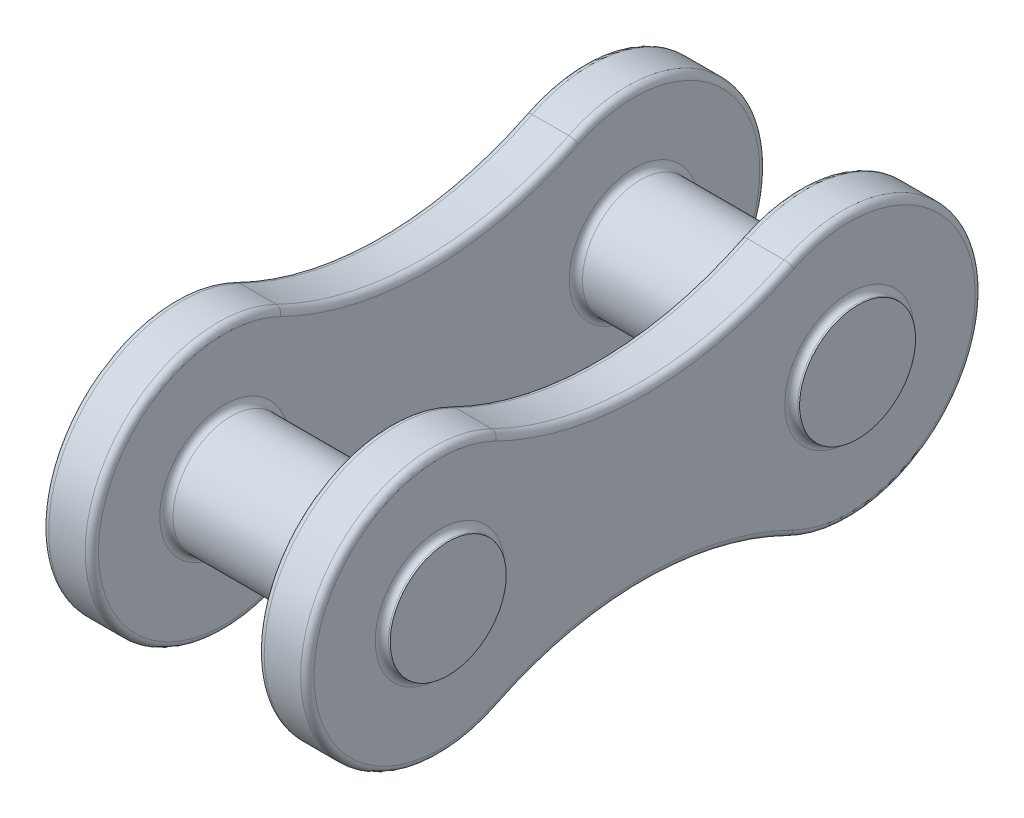
from build123d import *

# Parameters (mm, degrees)
SALIENTE_EXTRUIR1_START = 2.5
CROQUIS1_R              = 1.75
SALIENTE_EXTRUIR1_DEPTH = 1.5
SALIENTE_EXTRUIR2_START = -2.5
CROQUIS2_R              = 1.75
SALIENTE_EXTRUIR2_DEPTH = 1.5
CROQUIS3_R              = 1.75
SALIENTE_EXTRUIR3_DEPTH = 4.25
REDONDEO1_R             = 0.2


with BuildPart() as part:
    # Croquis1 → Saliente-Extruir1 (new body)
    with BuildSketch(Plane(origin=(0, 0, 0), x_dir=(0, 0, -1), z_dir=(1, 0, 0)).offset(SALIENTE_EXTRUIR1_START)):
        with BuildLine():
            ThreePointArc((-4.410714286, 3.589888009), (-10.175, 0), (-4.410714286, -3.589888009))
            ThreePointArc((-4.410714286, -3.589888009), (0, -2.564608032), (4.410714286, -3.589888009))
            ThreePointArc((4.410714286, -3.589888009), (10.175, 0), (4.410714286, 3.589888009))
            ThreePointArc((4.410714286, 3.589888009), (0, 2.564608032), (-4.410714286, 3.589888009))
        make_face()
        with Locations((-6.175, 0)):
            Circle(CROQUIS1_R, mode=Mode.SUBTRACT)
        with Locations((6.175, 0)):
            Circle(CROQUIS1_R, mode=Mode.SUBTRACT)
    extrude(amount=SALIENTE_EXTRUIR1_DEPTH)



with BuildPart() as body_2:
    # Croquis2 → Saliente-Extruir2 (new body)
    with BuildSketch(Plane(origin=(0, 0, 0), x_dir=(0, 0, -1), z_dir=(1, 0, 0)).offset(SALIENTE_EXTRUIR2_START)):
        with BuildLine():
            ThreePointArc((-4.410714286, 3.589888009), (0, 2.564608032), (4.410714286, 3.589888009))
            ThreePointArc((4.410714286, 3.589888009), (10.175, 0), (4.410714286, -3.589888009))
            ThreePointArc((4.410714286, -3.589888009), (0, -2.564608032), (-4.410714286, -3.589888009))
            ThreePointArc((-4.410714286, -3.589888009), (-10.175, 0), (-4.410714286, 3.589888009))
        make_face()
        with Locations((6.175, 0)):
            Circle(CROQUIS2_R, mode=Mode.SUBTRACT)
        with Locations((-6.175, 0)):
            Circle(CROQUIS2_R, mode=Mode.SUBTRACT)
    extrude(amount=-SALIENTE_EXTRUIR2_DEPTH)


with BuildPart() as part_1:
    add(part.part)

    add(body_2.part)  # Saliente-Extruir3 merges body 2
    # Croquis3 → Saliente-Extruir3 (add, symmetric)
    with BuildSketch(Plane(origin=(0, 0, 0), x_dir=(0, 0, -1), z_dir=(1, 0, 0))):
        with Locations((6.175, 0)):
            Circle(CROQUIS3_R)
        with Locations((-6.175, 0)):
            Circle(CROQUIS3_R)
    extrude(amount=SALIENTE_EXTRUIR3_DEPTH, both=True)

    # Redondeo1
    redondeo1_edges = [part_1.edges().sort_by_distance(p)[0] for p in [
        (2.5, 0, -4.425),
        (2.5, 0, 7.925),
        (2.5, 0, 10.175),
        (2.5, -2.564608032, 0),
        (2.5, 0, -10.175),
        (2.5, 2.564608032, 0),
        (-4, -2.564608032, 0),
        (-4, 0, -10.175),
        (-4, 2.564608032, 0),
        (-4, 0, 10.175),
        (-4, 0, -4.425),
        (-4, 0, 7.925),
        (-2.5, 2.564608032, 0),
        (-2.5, 0, -10.175),
        (-2.5, -2.564608032, 0),
        (-2.5, 0, 10.175),
        (-2.5, 0, -4.425),
        (-2.5, 0, 7.925),
        (4, 0, -4.425),
        (4, 0, -10.175),
        (4, -2.564608032, 0),
        (4, 0, 10.175),
        (4, 2.564608032, 0),
        (4, 0, 7.925),
    ]]
    fillet(redondeo1_edges, radius=REDONDEO1_R)


solid = part_1.part
